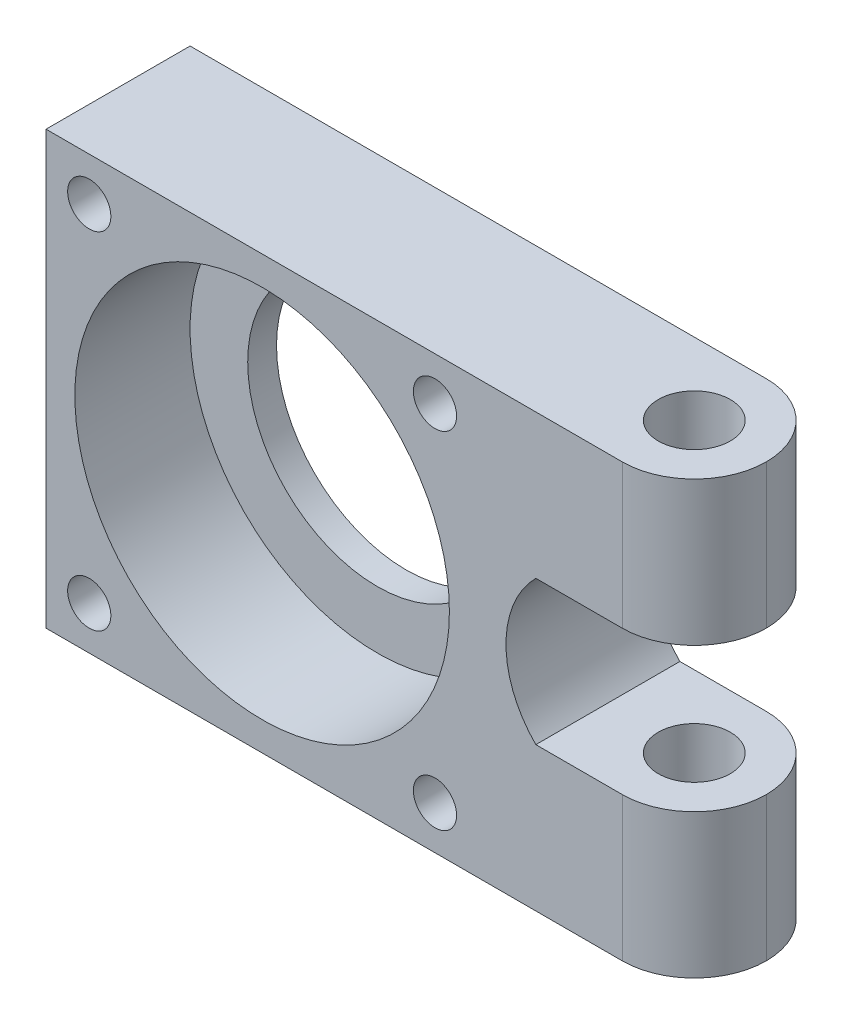
from build123d import *

# Parameters (mm, degrees)
RESSALTO_EXTRUS_O1_DEPTH = 10
CORTE_EXTRUS_O1_REACH    = 40.81
ESBO_O2_R                = 2.5
CORTE_EXTRUS_O2_DEPTH    = 10
ESBO_O5_R                = 13
CORTE_EXTRUS_O3_DEPTH    = 8
ESBO_O6_R                = 9
CORTE_EXTRUS_O4_DEPTH    = 29.200177304
FILETE1_R                = 5
ESBO_O7_R                = 1.5
CORTE_EXTRUS_O5_DEPTH    = 10


with BuildPart() as part:
    # Esboço1 → Ressalto-extrusão1 (new body)
    with BuildSketch(Plane.XY):
        Polygon((-22.5, 15), (22.5, 15), (22.5, 5), (11.5, 5), (11.5, -5), (22.5, -5), (22.5, -15), (-22.5, -15), align=None)
    extrude(amount=RESSALTO_EXTRUS_O1_DEPTH)

    # Corte-extrusão1: up to this face of the body (flat: up to its plane)
    corte_extrus_o1_end = Plane(part.part.faces().sort_by_distance((0, 15, 5))[0])
    # Esboço2 → Corte-extrusão1 (cut, up to the picked face)
    with BuildSketch(Plane.XZ.offset(15), mode=Mode.PRIVATE) as corte_extrus_o1_sk1:
        with Locations(Location((17.5, 5, 0), (0, 0, 270))):
            Circle(ESBO_O2_R)
    corte_extrus_o1_tool1 = split(extrude(corte_extrus_o1_sk1.sketch, amount=-CORTE_EXTRUS_O1_REACH, mode=Mode.PRIVATE), bisect_by=corte_extrus_o1_end, keep=Keep.BOTH, mode=Mode.PRIVATE)
    add(corte_extrus_o1_tool1.solids().sort_by(Axis((17.5, -15, 5), (0, 1, 0)))[0], mode=Mode.SUBTRACT)

    # Esboço4 → Corte-extrusão2 (cut)
    with BuildSketch(Plane.XY.offset(10)):
        with BuildLine():
            Line((11.5, 5), (11.5, -5))
            ThreePointArc((11.5, -5), (9.428932188, 0), (11.5, 5))
        make_face()
    extrude(amount=-CORTE_EXTRUS_O2_DEPTH, mode=Mode.SUBTRACT)

    # Esboço5 → Corte-extrusão3 (cut)
    with BuildSketch(Plane.XY.offset(10)):
        with Locations((-7.5, 0)):
            Circle(ESBO_O5_R)
    extrude(amount=-CORTE_EXTRUS_O3_DEPTH, mode=Mode.SUBTRACT)

    # Esboço6 → Corte-extrusão4 (cut, through all)
    with BuildSketch(Plane.XY.offset(2)):
        with Locations((-7.5, 0)):
            Circle(ESBO_O6_R)
    extrude(amount=-CORTE_EXTRUS_O4_DEPTH, mode=Mode.SUBTRACT)

    # Filete1
    filete1_edges = [part.edges().sort_by_distance(p)[0] for p in [
        (22.5, 10, 0),
        (22.5, 10, 10),
        (22.5, -10, 0),
        (22.5, -10, 10),
    ]]
    fillet(filete1_edges, radius=FILETE1_R - 0.0001)  # a hair under: the kernel refuses the full size

    # Esboço7 → Corte-extrusão5 (cut)
    with BuildSketch(Plane.XY.offset(10)):
        with Locations((-19.5, -12)):
            Circle(ESBO_O7_R)
        with Locations(Location((-19.5, 12, 0), (0, 0, 180))):
            Circle(ESBO_O7_R)
        with Locations((4.5, 12)):
            Circle(ESBO_O7_R)
        with Locations(Location((4.5, -12, 0), (0, 0, 180))):
            Circle(ESBO_O7_R)
    extrude(amount=-CORTE_EXTRUS_O5_DEPTH, mode=Mode.SUBTRACT)


solid = part.part
